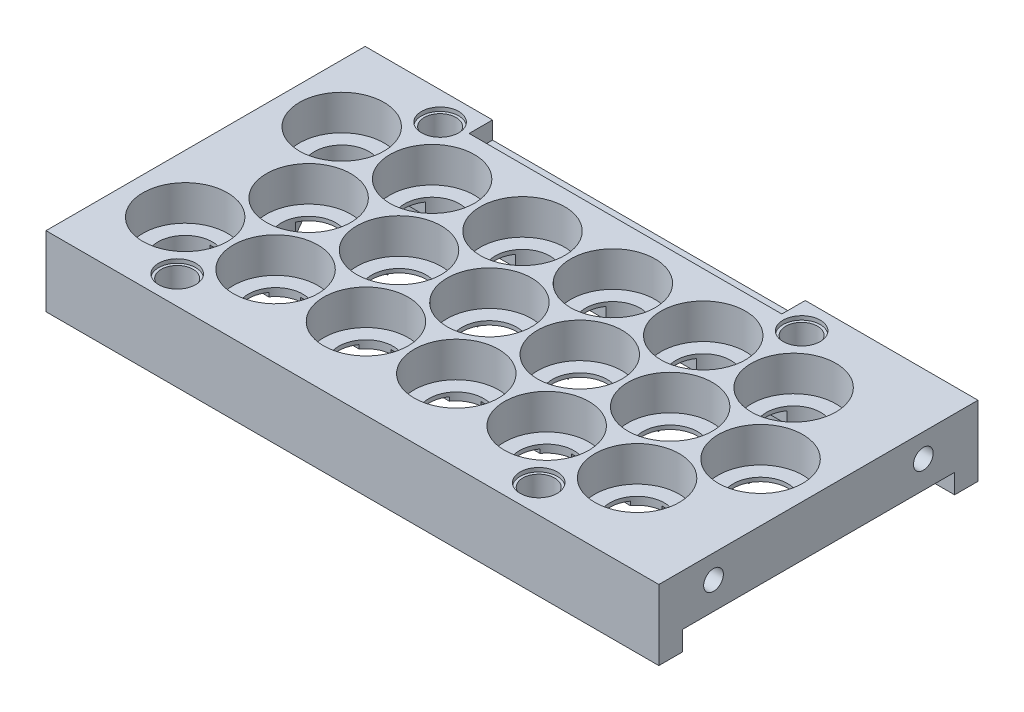
from build123d import *
from build123d.topology import SkipClean

# Parameters (mm, degrees)
SKETCH1_W            = 156.975
SKETCH1_H            = 81.746976195
SKETCH1_R            = 10.825
BOSS_EXTRUDE2_DEPTH  = 11
SKETCH1_3_R          = 10.825
SKETCH1_3_R_2        = 7
BOSS_EXTRUDE3_DEPTH  = 2
CUT_EXTRUDE1_DEPTH   = 1
CUT_EXTRUDE3_REACH   = 157.046
SKETCH9_R            = 4.0767
SKETCH10_R           = 4.7625
CUT_EXTRUDE4_DEPTH   = 1
SKETCH13_R           = 6.5
BOSS_EXTRUDE7_DEPTH  = 7
BOSS_EXTRUDE9_START  = 2
BOSS_EXTRUDE9_DEPTH  = 2
BOSS_EXTRUDE10_DEPTH = 2
SKETCH17_R           = 1.9431
CUT_EXTRUDE5_DEPTH   = 3.81
SKETCH18_W           = 80.1
SKETCH18_H           = 4.475
CUT_EXTRUDE6_DEPTH   = 6
SKETCH19_R           = 1.9431
CUT_EXTRUDE7_DEPTH   = 5
SKETCH20_R           = 2.5273
CUT_EXTRUDE8_DEPTH   = 10


with BuildPart() as part:
    # Sketch1 → Boss-Extrude2 (new body)
    with BuildSketch(Plane(origin=(0, 0, 0), x_dir=(1, 0, 0), z_dir=(0, 1, 0))):
        with Locations((63.6625, -20.048488098)):
            Rectangle(SKETCH1_W, SKETCH1_H)
        with Locations((0, -40.096976195)):
            Circle(SKETCH1_R, mode=Mode.SUBTRACT)
        with Locations((23.15, -40.096976195)):
            Circle(SKETCH1_R, mode=Mode.SUBTRACT)
        with Locations((46.3, -40.096976195)):
            Circle(SKETCH1_R, mode=Mode.SUBTRACT)
        with Locations((69.45, -40.096976195)):
            Circle(SKETCH1_R, mode=Mode.SUBTRACT)
        with Locations((92.6, -40.096976195)):
            Circle(SKETCH1_R, mode=Mode.SUBTRACT)
        with Locations((115.75, -40.096976195)):
            Circle(SKETCH1_R, mode=Mode.SUBTRACT)
        with Locations((11.575, -20.048488098)):
            Circle(SKETCH1_R, mode=Mode.SUBTRACT)
        Circle(SKETCH1_R, mode=Mode.SUBTRACT)
        with Locations((23.15, 0)):
            Circle(SKETCH1_R, mode=Mode.SUBTRACT)
        with Locations((34.725, -20.048488098)):
            Circle(SKETCH1_R, mode=Mode.SUBTRACT)
        with Locations((57.875, -20.048488098)):
            Circle(SKETCH1_R, mode=Mode.SUBTRACT)
        with Locations((46.3, 0)):
            Circle(SKETCH1_R, mode=Mode.SUBTRACT)
        with Locations((81.025, -20.048488098)):
            Circle(SKETCH1_R, mode=Mode.SUBTRACT)
        with Locations((69.45, 0)):
            Circle(SKETCH1_R, mode=Mode.SUBTRACT)
        with Locations((92.6, 0)):
            Circle(SKETCH1_R, mode=Mode.SUBTRACT)
        with Locations((104.175, -20.048488098)):
            Circle(SKETCH1_R, mode=Mode.SUBTRACT)
        with Locations((127.325, -20.048488098)):
            Circle(SKETCH1_R, mode=Mode.SUBTRACT)
        with Locations((115.75, 0)):
            Circle(SKETCH1_R, mode=Mode.SUBTRACT)
    extrude(amount=BOSS_EXTRUDE2_DEPTH)

    # Sketch1<3> → Boss-Extrude3 (add)
    # profile 1 of 18: a face of its own
    with BuildSketch(Plane(origin=(0, 0, 0), x_dir=(1, 0, 0), z_dir=(0, 1, 0))):
        Circle(SKETCH1_3_R)
        Circle(SKETCH1_3_R_2, mode=Mode.SUBTRACT)
    # profile 2 of 18: a face of its own
    with BuildSketch(Plane(origin=(0, 0, 0), x_dir=(1, 0, 0), z_dir=(0, 1, 0))):
        with Locations((11.575, -20.048488098)):
            Circle(SKETCH1_3_R)
        with Locations((11.575, -20.048488098)):
            Circle(SKETCH1_3_R_2, mode=Mode.SUBTRACT)
    # profile 3 of 18: a face of its own
    with BuildSketch(Plane(origin=(0, 0, 0), x_dir=(1, 0, 0), z_dir=(0, 1, 0))):
        with Locations((0, -40.096976195)):
            Circle(SKETCH1_3_R)
        with Locations((0, -40.096976195)):
            Circle(SKETCH1_3_R_2, mode=Mode.SUBTRACT)
    # profile 4 of 18: a face of its own
    with BuildSketch(Plane(origin=(0, 0, 0), x_dir=(1, 0, 0), z_dir=(0, 1, 0))):
        with Locations((23.15, 0)):
            Circle(SKETCH1_3_R)
        with Locations((23.15, 0)):
            Circle(SKETCH1_3_R_2, mode=Mode.SUBTRACT)
    # profile 5 of 18: a face of its own
    with BuildSketch(Plane(origin=(0, 0, 0), x_dir=(1, 0, 0), z_dir=(0, 1, 0))):
        with Locations((34.725, -20.048488098)):
            Circle(SKETCH1_3_R)
        with Locations((34.725, -20.048488098)):
            Circle(SKETCH1_3_R_2, mode=Mode.SUBTRACT)
    # profile 6 of 18: a face of its own
    with BuildSketch(Plane(origin=(0, 0, 0), x_dir=(1, 0, 0), z_dir=(0, 1, 0))):
        with Locations((23.15, -40.096976195)):
            Circle(SKETCH1_3_R)
        with Locations((23.15, -40.096976195)):
            Circle(SKETCH1_3_R_2, mode=Mode.SUBTRACT)
    # profile 7 of 18: a face of its own
    with BuildSketch(Plane(origin=(0, 0, 0), x_dir=(1, 0, 0), z_dir=(0, 1, 0))):
        with Locations((46.3, 0)):
            Circle(SKETCH1_3_R)
        with Locations((46.3, 0)):
            Circle(SKETCH1_3_R_2, mode=Mode.SUBTRACT)
    # profile 8 of 18: a face of its own
    with BuildSketch(Plane(origin=(0, 0, 0), x_dir=(1, 0, 0), z_dir=(0, 1, 0))):
        with Locations((57.875, -20.048488098)):
            Circle(SKETCH1_3_R)
        with Locations((57.875, -20.048488098)):
            Circle(SKETCH1_3_R_2, mode=Mode.SUBTRACT)
    # profile 9 of 18: a face of its own
    with BuildSketch(Plane(origin=(0, 0, 0), x_dir=(1, 0, 0), z_dir=(0, 1, 0))):
        with Locations((46.3, -40.096976195)):
            Circle(SKETCH1_3_R)
        with Locations((46.3, -40.096976195)):
            Circle(SKETCH1_3_R_2, mode=Mode.SUBTRACT)
    # profile 10 of 18: a face of its own
    with BuildSketch(Plane(origin=(0, 0, 0), x_dir=(1, 0, 0), z_dir=(0, 1, 0))):
        with Locations((69.45, 0)):
            Circle(SKETCH1_3_R)
        with Locations((69.45, 0)):
            Circle(SKETCH1_3_R_2, mode=Mode.SUBTRACT)
    # profile 11 of 18: a face of its own
    with BuildSketch(Plane(origin=(0, 0, 0), x_dir=(1, 0, 0), z_dir=(0, 1, 0))):
        with Locations((81.025, -20.048488098)):
            Circle(SKETCH1_3_R)
        with Locations((81.025, -20.048488098)):
            Circle(SKETCH1_3_R_2, mode=Mode.SUBTRACT)
    # profile 12 of 18: a face of its own
    with BuildSketch(Plane(origin=(0, 0, 0), x_dir=(1, 0, 0), z_dir=(0, 1, 0))):
        with Locations((69.45, -40.096976195)):
            Circle(SKETCH1_3_R)
        with Locations((69.45, -40.096976195)):
            Circle(SKETCH1_3_R_2, mode=Mode.SUBTRACT)
    # profile 13 of 18: a face of its own
    with BuildSketch(Plane(origin=(0, 0, 0), x_dir=(1, 0, 0), z_dir=(0, 1, 0))):
        with Locations((92.6, 0)):
            Circle(SKETCH1_3_R)
        with Locations((92.6, 0)):
            Circle(SKETCH1_3_R_2, mode=Mode.SUBTRACT)
    # profile 14 of 18: a face of its own
    with BuildSketch(Plane(origin=(0, 0, 0), x_dir=(1, 0, 0), z_dir=(0, 1, 0))):
        with Locations((104.175, -20.048488098)):
            Circle(SKETCH1_3_R)
        with Locations((104.175, -20.048488098)):
            Circle(SKETCH1_3_R_2, mode=Mode.SUBTRACT)
    # profile 15 of 18: a face of its own
    with BuildSketch(Plane(origin=(0, 0, 0), x_dir=(1, 0, 0), z_dir=(0, 1, 0))):
        with Locations((92.6, -40.096976195)):
            Circle(SKETCH1_3_R)
        with Locations((92.6, -40.096976195)):
            Circle(SKETCH1_3_R_2, mode=Mode.SUBTRACT)
    # profile 16 of 18: a face of its own
    with BuildSketch(Plane(origin=(0, 0, 0), x_dir=(1, 0, 0), z_dir=(0, 1, 0))):
        with Locations((115.75, 0)):
            Circle(SKETCH1_3_R)
        with Locations((115.75, 0)):
            Circle(SKETCH1_3_R_2, mode=Mode.SUBTRACT)
    # profile 17 of 18: a face of its own
    with BuildSketch(Plane(origin=(0, 0, 0), x_dir=(1, 0, 0), z_dir=(0, 1, 0))):
        with Locations((127.325, -20.048488098)):
            Circle(SKETCH1_3_R)
        with Locations((127.325, -20.048488098)):
            Circle(SKETCH1_3_R_2, mode=Mode.SUBTRACT)
    # profile 18 of 18: a face of its own
    with BuildSketch(Plane(origin=(0, 0, 0), x_dir=(1, 0, 0), z_dir=(0, 1, 0))):
        with Locations((115.75, -40.096976195)):
            Circle(SKETCH1_3_R)
        with Locations((115.75, -40.096976195)):
            Circle(SKETCH1_3_R_2, mode=Mode.SUBTRACT)
    extrude(amount=BOSS_EXTRUDE3_DEPTH)

    # Sketch2 → Cut-Extrude1 (cut)
    with BuildSketch(Plane.XZ):
        with BuildLine():
            Line((-0.591820292, 33.12203901), (5.238617062, 23.023425283))
            ThreePointArc((5.238617062, 23.023425283), (8.075, 26.110665924), (12.166820292, 27.023425283))
            Line((12.166820292, 27.023425283), (6.92820323, 36.096976195))
            Line((6.92820323, 36.096976195), (17.405437353, 36.096976195))
            ThreePointArc((17.405437353, 36.096976195), (16.15, 40.096976195), (17.405437353, 44.096976195))
            Line((17.405437353, 44.096976195), (5.744562647, 44.096976195))
            ThreePointArc((5.744562647, 44.096976195), (6.062177826, 36.596976195), (-0.591820292, 33.12203901))
        make_face()
        with BuildLine():
            Line((27.79679677, 24.048488098), (17.319562647, 24.048488098))
            ThreePointArc((17.319562647, 24.048488098), (18.575, 20.048488098), (17.319562647, 16.048488098))
            Line((17.319562647, 16.048488098), (27.79679677, 16.048488098))
            Line((27.79679677, 16.048488098), (22.558179708, 6.974937186))
            ThreePointArc((22.558179708, 6.974937186), (26.124937186, 6.336382938), (28.894562647, 4))
            Line((28.894562647, 4), (6.92820323, 4))
            Line((6.92820323, 4), (12.166820292, 13.073550912))
            ThreePointArc((12.166820292, 13.073550912), (8.075, 13.986310271), (5.238617062, 17.073550912))
            Line((5.238617062, 17.073550912), (-0.591820292, 6.974937186))
            ThreePointArc((-0.591820292, 6.974937186), (2.974937186, 6.336382938), (5.744562647, 4))
            Line((5.744562647, 4), (0, 4))
            ThreePointArc((0, 4), (-4, 0), (0, -4))
            Line((0, -4), (115.75, -4))
            ThreePointArc((115.75, -4), (119.75, 0), (115.75, 4))
            Line((115.75, 4), (99.52820323, 4))
            Line((99.52820323, 4), (104.766820292, 13.073550912))
            ThreePointArc((104.766820292, 13.073550912), (97.175, 20.048488098), (104.766820292, 27.023425283))
            Line((104.766820292, 27.023425283), (99.52820323, 36.096976195))
            Line((99.52820323, 36.096976195), (110.005437353, 36.096976195))
            ThreePointArc((110.005437353, 36.096976195), (108.75, 40.096976195), (110.005437353, 44.096976195))
            Line((110.005437353, 44.096976195), (98.344562647, 44.096976195))
            ThreePointArc((98.344562647, 44.096976195), (98.662177826, 36.596976195), (92.008179708, 33.12203901))
            Line((92.008179708, 33.12203901), (97.24679677, 24.048488098))
            Line((97.24679677, 24.048488098), (86.769562647, 24.048488098))
            ThreePointArc((86.769562647, 24.048488098), (88.025, 20.048488098), (86.769562647, 16.048488098))
            Line((86.769562647, 16.048488098), (97.24679677, 16.048488098))
            Line((97.24679677, 16.048488098), (92.008179708, 6.974937186))
            ThreePointArc((92.008179708, 6.974937186), (95.574937186, 6.336382938), (98.344562647, 4))
            Line((98.344562647, 4), (76.37820323, 4))
            Line((76.37820323, 4), (81.616820292, 13.073550912))
            ThreePointArc((81.616820292, 13.073550912), (74.025, 20.048488098), (81.616820292, 27.023425283))
            Line((81.616820292, 27.023425283), (76.37820323, 36.096976195))
            Line((76.37820323, 36.096976195), (86.855437353, 36.096976195))
            ThreePointArc((86.855437353, 36.096976195), (85.6, 40.096976195), (86.855437353, 44.096976195))
            Line((86.855437353, 44.096976195), (75.194562647, 44.096976195))
            ThreePointArc((75.194562647, 44.096976195), (75.512177826, 36.596976195), (68.858179708, 33.12203901))
            Line((68.858179708, 33.12203901), (74.09679677, 24.048488098))
            Line((74.09679677, 24.048488098), (63.619562647, 24.048488098))
            ThreePointArc((63.619562647, 24.048488098), (64.875, 20.048488098), (63.619562647, 16.048488098))
            Line((63.619562647, 16.048488098), (74.09679677, 16.048488098))
            Line((74.09679677, 16.048488098), (68.858179708, 6.974937186))
            ThreePointArc((68.858179708, 6.974937186), (72.424937186, 6.336382938), (75.194562647, 4))
            Line((75.194562647, 4), (53.22820323, 4))
            Line((53.22820323, 4), (58.466820292, 13.073550912))
            ThreePointArc((58.466820292, 13.073550912), (50.875, 20.048488098), (58.466820292, 27.023425283))
            Line((58.466820292, 27.023425283), (53.22820323, 36.096976195))
            Line((53.22820323, 36.096976195), (63.705437353, 36.096976195))
            ThreePointArc((63.705437353, 36.096976195), (62.45, 40.096976195), (63.705437353, 44.096976195))
            Line((63.705437353, 44.096976195), (52.044562647, 44.096976195))
            ThreePointArc((52.044562647, 44.096976195), (52.362177826, 36.596976195), (45.708179708, 33.12203901))
            Line((45.708179708, 33.12203901), (50.94679677, 24.048488098))
            Line((50.94679677, 24.048488098), (40.469562647, 24.048488098))
            ThreePointArc((40.469562647, 24.048488098), (41.725, 20.048488098), (40.469562647, 16.048488098))
            Line((40.469562647, 16.048488098), (50.94679677, 16.048488098))
            Line((50.94679677, 16.048488098), (45.708179708, 6.974937186))
            ThreePointArc((45.708179708, 6.974937186), (49.274937186, 6.336382938), (52.044562647, 4))
            Line((52.044562647, 4), (30.07820323, 4))
            Line((30.07820323, 4), (35.316820292, 13.073550912))
            ThreePointArc((35.316820292, 13.073550912), (27.725, 20.048488098), (35.316820292, 27.023425283))
            Line((35.316820292, 27.023425283), (30.07820323, 36.096976195))
            Line((30.07820323, 36.096976195), (40.555437353, 36.096976195))
            ThreePointArc((40.555437353, 36.096976195), (39.3, 40.096976195), (40.555437353, 44.096976195))
            Line((40.555437353, 44.096976195), (28.894562647, 44.096976195))
            ThreePointArc((28.894562647, 44.096976195), (29.212177826, 36.596976195), (22.558179708, 33.12203901))
            Line((22.558179708, 33.12203901), (27.79679677, 24.048488098))
        make_face()
        with BuildLine():
            Line((127.916820292, 27.023425283), (122.086382938, 37.12203901))
            ThreePointArc((122.086382938, 37.12203901), (119.25, 34.034798369), (115.158179708, 33.12203901))
            Line((115.158179708, 33.12203901), (120.39679677, 24.048488098))
            Line((120.39679677, 24.048488098), (109.919562647, 24.048488098))
            ThreePointArc((109.919562647, 24.048488098), (111.175, 20.048488098), (109.919562647, 16.048488098))
            Line((109.919562647, 16.048488098), (120.39679677, 16.048488098))
            Line((120.39679677, 16.048488098), (115.158179708, 6.974937186))
            ThreePointArc((115.158179708, 6.974937186), (119.25, 6.062177826), (122.086382938, 2.974937186))
            Line((122.086382938, 2.974937186), (127.916820292, 13.073550912))
            ThreePointArc((127.916820292, 13.073550912), (120.325, 20.048488098), (127.916820292, 27.023425283))
        make_face()
    extrude(amount=-CUT_EXTRUDE1_DEPTH, mode=Mode.SUBTRACT)

    # Sketch9 → Cut-Extrude3 (cut, up to next)
    with BuildSketch(Plane(origin=(0, 11, 0), x_dir=(1, 0, 0), z_dir=(0, 1, 0)), mode=Mode.PRIVATE) as cut_extrude3_sk1:
        with Locations((11.575, 13.625)):
            Circle(SKETCH9_R)
    cut_extrude3_tool1 = extrude(cut_extrude3_sk1.sketch, amount=-CUT_EXTRUDE3_REACH, mode=Mode.PRIVATE) & part.part
    # Sketch9 → Cut-Extrude3 (cut, up to next)
    with BuildSketch(Plane(origin=(0, 11, 0), x_dir=(1, 0, 0), z_dir=(0, 1, 0)), mode=Mode.PRIVATE) as cut_extrude3_sk2:
        with Locations((11.575, -53.721976195)):
            Circle(SKETCH9_R)
    cut_extrude3_tool2 = extrude(cut_extrude3_sk2.sketch, amount=-CUT_EXTRUDE3_REACH, mode=Mode.PRIVATE) & part.part
    # Sketch9 → Cut-Extrude3 (cut, up to next)
    with BuildSketch(Plane(origin=(0, 11, 0), x_dir=(1, 0, 0), z_dir=(0, 1, 0)), mode=Mode.PRIVATE) as cut_extrude3_sk3:
        with Locations((104.175, -53.721976195)):
            Circle(SKETCH9_R)
    cut_extrude3_tool3 = extrude(cut_extrude3_sk3.sketch, amount=-CUT_EXTRUDE3_REACH, mode=Mode.PRIVATE) & part.part
    # Sketch9 → Cut-Extrude3 (cut, up to next)
    with BuildSketch(Plane(origin=(0, 11, 0), x_dir=(1, 0, 0), z_dir=(0, 1, 0)), mode=Mode.PRIVATE) as cut_extrude3_sk4:
        with Locations((104.175, 13.625)):
            Circle(SKETCH9_R)
    cut_extrude3_tool4 = extrude(cut_extrude3_sk4.sketch, amount=-CUT_EXTRUDE3_REACH, mode=Mode.PRIVATE) & part.part
    add(cut_extrude3_tool1.solids().sort_by_distance((11.575, 11, -13.625))[0], mode=Mode.SUBTRACT)
    add(cut_extrude3_tool2.solids().sort_by_distance((11.575, 11, 53.721976))[0], mode=Mode.SUBTRACT)
    add(cut_extrude3_tool3.solids().sort_by_distance((104.175, 11, 53.721976))[0], mode=Mode.SUBTRACT)
    add(cut_extrude3_tool4.solids().sort_by_distance((104.175, 11, -13.625))[0], mode=Mode.SUBTRACT)

    # Sketch10 → Cut-Extrude4 (cut)
    with BuildSketch(Plane(origin=(0, 11, 0), x_dir=(1, 0, 0), z_dir=(0, 1, 0))):
        with Locations((11.575, 13.625)):
            Circle(SKETCH10_R)
        with Locations((104.175, 13.625)):
            Circle(SKETCH10_R)
        with Locations((104.175, -53.721976195)):
            Circle(SKETCH10_R)
        with Locations((11.575, -53.721976195)):
            Circle(SKETCH10_R)
    extrude(amount=-CUT_EXTRUDE4_DEPTH, mode=Mode.SUBTRACT)

    # Sketch13 → Boss-Extrude7 (add)
    # profile 1 of 2: a face of its own
    with BuildSketch(Plane.XZ):
        with BuildLine():
            ThreePointArc((3.665512027, 54.921976195), (11.575, 45.721976195), (19.484487973, 54.921976195))
            Line((19.484487973, 54.921976195), (96.265512027, 54.921976195))
            ThreePointArc((96.265512027, 54.921976195), (104.175, 45.721976195), (112.084487973, 54.921976195))
            Line((112.084487973, 54.921976195), (142.15, 54.921976195))
            Line((142.15, 54.921976195), (142.15, 60.921976195))
            Line((142.15, 60.921976195), (-14.825, 60.921976195))
            Line((-14.825, 60.921976195), (-14.825, 54.921976195))
            Line((-14.825, 54.921976195), (3.665512027, 54.921976195))
        make_face()
        with Locations((11.575, 53.721976195)):
            Circle(SKETCH13_R, mode=Mode.SUBTRACT)
        with Locations((104.175, 53.721976195)):
            Circle(SKETCH13_R, mode=Mode.SUBTRACT)
    # profile 2 of 2: a face of its own
    with BuildSketch(Plane.XZ):
        with BuildLine():
            Line((-14.825, -14.825), (-14.825, -20.825))
            Line((-14.825, -20.825), (142.15, -20.825))
            Line((142.15, -20.825), (142.15, -14.825))
            Line((142.15, -14.825), (112.084487973, -14.825))
            ThreePointArc((112.084487973, -14.825), (104.175, -5.625), (96.265512027, -14.825))
            Line((96.265512027, -14.825), (19.484487973, -14.825))
            ThreePointArc((19.484487973, -14.825), (11.575, -5.625), (3.665512027, -14.825))
            Line((3.665512027, -14.825), (-14.825, -14.825))
        make_face()
        with Locations((11.575, -13.625)):
            Circle(SKETCH13_R, mode=Mode.SUBTRACT)
        with Locations((104.175, -13.625)):
            Circle(SKETCH13_R, mode=Mode.SUBTRACT)
    extrude(amount=BOSS_EXTRUDE7_DEPTH)

    # Sketch14 → Boss-Extrude9 (add)
    with SkipClean():  # the faces are left unmerged after this step: merging them gives an invalid solid
        with BuildSketch(Plane.XZ.offset(BOSS_EXTRUDE9_START)):
            with BuildLine():
                Line((142.15, 54.921976195), (142.15, -14.825))
                Line((142.15, -14.825), (112.084487973, -14.825))
                ThreePointArc((112.084487973, -14.825), (104.175, -5.625), (96.265512027, -14.825))
                Line((96.265512027, -14.825), (19.484487973, -14.825))
                ThreePointArc((19.484487973, -14.825), (11.575, -5.625), (3.665512027, -14.825))
                Line((3.665512027, -14.825), (-14.825, -14.825))
                Line((-14.825, -14.825), (-14.825, 54.921976195))
                Line((-14.825, 54.921976195), (3.665512027, 54.921976195))
                ThreePointArc((3.665512027, 54.921976195), (11.575, 45.721976195), (19.484487973, 54.921976195))
                Line((19.484487973, 54.921976195), (96.265512027, 54.921976195))
                ThreePointArc((96.265512027, 54.921976195), (104.175, 45.721976195), (112.084487973, 54.921976195))
                Line((112.084487973, 54.921976195), (142.15, 54.921976195))
            make_face()
            with BuildLine():
                Line((5.238617062, 17.073550912), (-0.591820292, 6.974937186))
                ThreePointArc((-0.591820292, 6.974937186), (-6.062177826, -3.5), (5.744562647, -4))
                Line((5.744562647, -4), (17.405437353, -4))
                ThreePointArc((17.405437353, -4), (23.15, -7), (28.894562647, -4))
                Line((28.894562647, -4), (40.555437353, -4))
                ThreePointArc((40.555437353, -4), (46.3, -7), (52.044562647, -4))
                Line((52.044562647, -4), (63.705437353, -4))
                ThreePointArc((63.705437353, -4), (69.45, -7), (75.194562647, -4))
                Line((75.194562647, -4), (86.855437353, -4))
                ThreePointArc((86.855437353, -4), (92.6, -7), (98.344562647, -4))
                Line((98.344562647, -4), (110.005437353, -4))
                ThreePointArc((110.005437353, -4), (119.25, -6.062177826), (122.086382938, 2.974937186))
                Line((122.086382938, 2.974937186), (127.916820292, 13.073550912))
                ThreePointArc((127.916820292, 13.073550912), (134.325, 20.048488098), (127.916820292, 27.023425283))
                Line((127.916820292, 27.023425283), (122.086382938, 37.12203901))
                ThreePointArc((122.086382938, 37.12203901), (119.25, 46.159154022), (110.005437353, 44.096976195))
                Line((110.005437353, 44.096976195), (98.344562647, 44.096976195))
                ThreePointArc((98.344562647, 44.096976195), (92.6, 47.096976195), (86.855437353, 44.096976195))
                Line((86.855437353, 44.096976195), (75.194562647, 44.096976195))
                ThreePointArc((75.194562647, 44.096976195), (69.45, 47.096976195), (63.705437353, 44.096976195))
                Line((63.705437353, 44.096976195), (52.044562647, 44.096976195))
                ThreePointArc((52.044562647, 44.096976195), (46.3, 47.096976195), (40.555437353, 44.096976195))
                Line((40.555437353, 44.096976195), (28.894562647, 44.096976195))
                ThreePointArc((28.894562647, 44.096976195), (23.15, 47.096976195), (17.405437353, 44.096976195))
                Line((17.405437353, 44.096976195), (5.744562647, 44.096976195))
                ThreePointArc((5.744562647, 44.096976195), (-6.062177826, 43.596976195), (-0.591820292, 33.12203901))
                Line((-0.591820292, 33.12203901), (5.238617062, 23.023425283))
                ThreePointArc((5.238617062, 23.023425283), (4.575, 20.048488098), (5.238617062, 17.073550912))
            make_face(mode=Mode.SUBTRACT)
        extrude(amount=-BOSS_EXTRUDE9_DEPTH)

    # Sketch16 → Boss-Extrude10 (add)
    with SkipClean():  # the faces are left unmerged after this step: merging them gives an invalid solid
        with BuildSketch(Plane.XZ):
            with BuildLine():
                Line((15.536128823, 32.859238845), (20.688871177, 29.884301659))
                ThreePointArc((20.688871177, 29.884301659), (21.237909283, 27.835263554), (19.188871177, 27.286225448))
                Line((19.188871177, 27.286225448), (14.036128823, 30.261162634))
                ThreePointArc((14.036128823, 30.261162634), (13.487090717, 32.310200739), (15.536128823, 32.859238845))
            make_face()
            with BuildLine():
                Line((38.686128823, 32.859238845), (43.838871177, 29.884301659))
                ThreePointArc((43.838871177, 29.884301659), (44.387909283, 27.835263554), (42.338871177, 27.286225448))
                Line((42.338871177, 27.286225448), (37.186128823, 30.261162634))
                ThreePointArc((37.186128823, 30.261162634), (36.637090717, 32.310200739), (38.686128823, 32.859238845))
            make_face()
            with BuildLine():
                Line((61.836128823, 32.859238845), (66.988871177, 29.884301659))
                ThreePointArc((66.988871177, 29.884301659), (67.537909283, 27.835263554), (65.488871177, 27.286225448))
                Line((65.488871177, 27.286225448), (60.336128823, 30.261162634))
                ThreePointArc((60.336128823, 30.261162634), (59.787090717, 32.310200739), (61.836128823, 32.859238845))
            make_face()
            with BuildLine():
                Line((84.986128823, 32.859238845), (90.138871177, 29.884301659))
                ThreePointArc((90.138871177, 29.884301659), (90.687909283, 27.835263554), (88.638871177, 27.286225448))
                Line((88.638871177, 27.286225448), (83.486128823, 30.261162634))
                ThreePointArc((83.486128823, 30.261162634), (82.937090717, 32.310200739), (84.986128823, 32.859238845))
            make_face()
            with BuildLine():
                Line((108.136128823, 32.859238845), (113.288871177, 29.884301659))
                ThreePointArc((113.288871177, 29.884301659), (113.837909283, 27.835263554), (111.788871177, 27.286225448))
                Line((111.788871177, 27.286225448), (106.636128823, 30.261162634))
                ThreePointArc((106.636128823, 30.261162634), (106.087090717, 32.310200739), (108.136128823, 32.859238845))
            make_face()
            with BuildLine():
                Line((15.536128823, 7.23773735), (20.688871177, 10.212674536))
                ThreePointArc((20.688871177, 10.212674536), (21.237909283, 12.261712642), (19.188871177, 12.810750747))
                Line((19.188871177, 12.810750747), (14.036128823, 9.835813562))
                ThreePointArc((14.036128823, 9.835813562), (13.487090717, 7.786775456), (15.536128823, 7.23773735))
            make_face()
            with BuildLine():
                Line((38.686128823, 7.23773735), (43.838871177, 10.212674536))
                ThreePointArc((43.838871177, 10.212674536), (44.387909283, 12.261712642), (42.338871177, 12.810750747))
                Line((42.338871177, 12.810750747), (37.186128823, 9.835813562))
                ThreePointArc((37.186128823, 9.835813562), (36.637090717, 7.786775456), (38.686128823, 7.23773735))
            make_face()
            with BuildLine():
                Line((61.836128823, 7.23773735), (66.988871177, 10.212674536))
                ThreePointArc((66.988871177, 10.212674536), (67.537909283, 12.261712642), (65.488871177, 12.810750747))
                Line((65.488871177, 12.810750747), (60.336128823, 9.835813562))
                ThreePointArc((60.336128823, 9.835813562), (59.787090717, 7.786775456), (61.836128823, 7.23773735))
            make_face()
            with BuildLine():
                Line((84.986128823, 7.23773735), (90.138871177, 10.212674536))
                ThreePointArc((90.138871177, 10.212674536), (90.687909283, 12.261712642), (88.638871177, 12.810750747))
                Line((88.638871177, 12.810750747), (83.486128823, 9.835813562))
                ThreePointArc((83.486128823, 9.835813562), (82.937090717, 7.786775456), (84.986128823, 7.23773735))
            make_face()
            with BuildLine():
                Line((108.136128823, 7.23773735), (113.288871177, 10.212674536))
                ThreePointArc((113.288871177, 10.212674536), (113.837909283, 12.261712642), (111.788871177, 12.810750747))
                Line((111.788871177, 12.810750747), (106.636128823, 9.835813562))
                ThreePointArc((106.636128823, 9.835813562), (106.087090717, 7.786775456), (108.136128823, 7.23773735))
            make_face()
        extrude(amount=BOSS_EXTRUDE10_DEPTH)

    # Sketch17 → Cut-Extrude5 (cut)
    with BuildSketch(Plane(origin=(0, -2, 0), x_dir=(-1, 0, 0), z_dir=(0, -1, 0))):
        with Locations((10.825, -49.509476195)):
            Circle(SKETCH17_R)
        with Locations((-57.875, -49.509476195)):
            Circle(SKETCH17_R)
        with Locations((-132.15, -49.509476195)):
            Circle(SKETCH17_R)
        with Locations((-132.15, 9.4125)):
            Circle(SKETCH17_R)
        with Locations((-57.875, 9.4125)):
            Circle(SKETCH17_R)
        with Locations((10.825, 9.4125)):
            Circle(SKETCH17_R)
    extrude(amount=-CUT_EXTRUDE5_DEPTH, mode=Mode.SUBTRACT)

    # Sketch18 → Cut-Extrude6 (cut)
    with BuildSketch(Plane(origin=(0, 0, -20.825), x_dir=(-1, 0, 0), z_dir=(0, 0, -1))):
        with Locations((-57.85, 8.7625)):
            Rectangle(SKETCH18_W, SKETCH18_H)
    extrude(amount=-CUT_EXTRUDE6_DEPTH, mode=Mode.SUBTRACT)

    # Sketch19 → Cut-Extrude7 (cut)
    with BuildSketch(Plane(origin=(0, 0, -20.825), x_dir=(-1, 0, 0), z_dir=(0, 0, -1))):
        with Locations((-85.9, -0.2375)):
            Circle(SKETCH19_R)
        with Locations((-29.8, -0.2375)):
            Circle(SKETCH19_R)
    extrude(amount=-CUT_EXTRUDE7_DEPTH, mode=Mode.SUBTRACT)

    # Sketch20 → Cut-Extrude8 (cut)
    with BuildSketch(Plane(origin=(142.15, 0, 0), x_dir=(0, 0, -1), z_dir=(1, 0, 0))):
        with Locations((-46.921976195, 5)):
            Circle(SKETCH20_R)
        with Locations((6.825, 5)):
            Circle(SKETCH20_R)
    extrude(amount=-CUT_EXTRUDE8_DEPTH, mode=Mode.SUBTRACT)


solid = part.part
